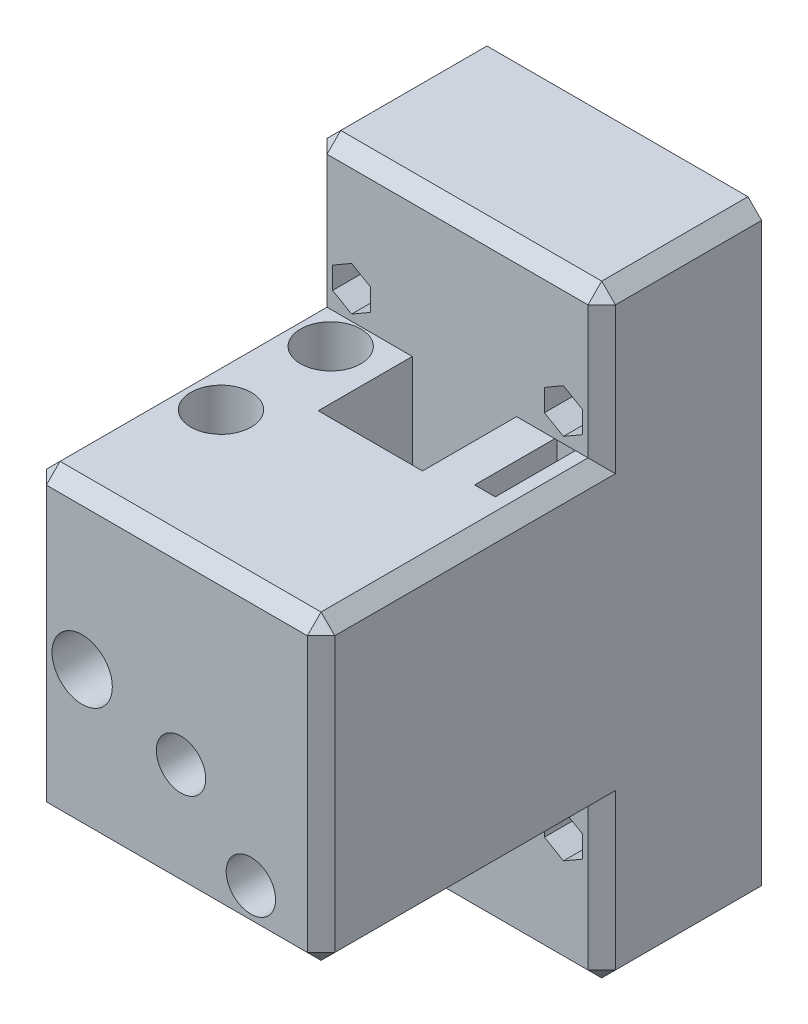
from build123d import *

# Parameters (mm, degrees)
SKETCH1_W                = 34.3
SKETCH1_H                = 70.3
SKETCH1_W_2              = 110
SKETCH1_H_2              = 9.85
BOSS_EXTRUDE1_DEPTH      = 15.048264774
BOSS_EXTRUDE3_DEPTH      = 10
BOSS_EXTRUDE4_DEPTH      = 27.518264774
CUT_EXTRUDE1_DEPTH       = 97.82308708
CUT_EXTRUDE1_DEPTH_BACK  = 97.82308708
SKETCH4_R                = 2
CUT_EXTRUDE3_DEPTH       = 77.2053469
CUT_EXTRUDE3_DEPTH_BACK  = 77.2053469
SKETCH8_W                = 129.903835659
SKETCH8_H                = 83.627886417
SKETCH9_W                = 44.357950904
SKETCH9_H                = 70.607950904
SKETCH9_W_2              = 20
SKETCH9_H_2              = 40
BOSS_EXTRUDE5_DEPTH      = 15.048264774
SKETCH10_W               = 20.2
SKETCH10_H               = 40.2
SKETCH10_W_2             = 20
SKETCH10_H_2             = 40
CUT_EXTRUDE6_DEPTH       = 81.359319258
SKETCH11_R               = 3
CUT_EXTRUDE7_DEPTH       = 30
CUT_EXTRUDE8_DEPTH       = 105.313703151
CUT_EXTRUDE8_DEPTH_BACK  = 8
SKETCH12_R               = 5.5
CUT_EXTRUDE10_DEPTH      = 81.359319258
CUT_EXTRUDE10_DEPTH_BACK = 81.359319258
SKETCH14_W               = 7.032197939
SKETCH14_H               = 32
SKETCH19_W               = 44.357950904
SKETCH19_H               = 70.453975452
BOSS_EXTRUDE9_DEPTH      = 3
BOSS_EXTRUDE6_DEPTH      = 19.3
SKETCH16_R               = 3.4
BOSS_EXTRUDE7_DEPTH      = 2.35
SKETCH18_W               = 18.048264774
SKETCH18_H               = 5.321024548
BOSS_EXTRUDE8_DEPTH      = 15
SKETCH20_R               = 3.4
BOSS_EXTRUDE10_DEPTH     = 1.85
BOSS_EXTRUDE11_DEPTH     = 15.85
SKETCH22_R               = 3.4
BOSS_EXTRUDE12_DEPTH     = 1.8
BOSS_EXTRUDE13_OUTLINE_R = 3.4
BOSS_EXTRUDE13_DEPTH     = 34.003975452
SKETCH26_W               = 18.048264774
SKETCH26_H               = 2.15
BOSS_EXTRUDE16_DEPTH     = 5.321024548
SKETCH24_R               = 3.4
BOSS_EXTRUDE14_DEPTH     = 1.8
BOSS_EXTRUDE15_DEPTH     = 18.503975452
CUT_EXTRUDE11_DEPTH      = 83.549671178
CUT_EXTRUDE11_DEPTH_BACK = 83.549671178
SKETCH27_R               = 2.5
CUT_EXTRUDE12_DEPTH      = 81.923545348
CUT_EXTRUDE12_DEPTH_BACK = 81.923545348
SKETCH28_R               = 2.5
CUT_EXTRUDE15_DEPTH      = 102.880674814
CUT_EXTRUDE15_DEPTH_BACK = 102.880674814
SKETCH29_W               = 3.770821646
SKETCH29_H               = 15
SKETCH30_W               = 52.566529548
SKETCH30_H               = 26.651024548
SKETCH30_R               = 2
SKETCH30_H_2             = 28.348975452
BOSS_EXTRUDE17_DEPTH     = 19.3
CHAMFER1_SIZE            = 2.5
CUT_EXTRUDE16_DEPTH      = 84.96040374
CUT_EXTRUDE16_DEPTH_BACK = 10
SKETCH31_R               = 3
CUT_EXTRUDE17_DEPTH      = 33
SKETCH33_R               = 5.5
CUT_EXTRUDE18_DEPTH      = 8
CUT_EXTRUDE19_DEPTH      = 20
CUT_EXTRUDE20_DEPTH      = 33
SKETCH36_R               = 4.5
CUT_EXTRUDE21_DEPTH      = 12
SKETCH37_R               = 4.5
CUT_EXTRUDE22_DEPTH      = 4


# Read off the part's stored shape, not the designer's step: Boss-Extrude13
with BuildPart() as part:
    # Sketch1 → Boss-Extrude1 (new body)
    # profile 1 of 2: a face of its own
    with BuildSketch(Plane.YZ):
        Rectangle(SKETCH1_W, SKETCH1_H)
        with BuildLine():
            Line((-10.15, 6.7), (-10.15, -6.7))
            ThreePointArc((-10.15, -6.7), (-9.871751442, -7.371751442), (-9.2, -7.65))
            Line((-9.2, -7.65), (-8.5, -7.65))
            ThreePointArc((-8.5, -7.65), (-8.181801948, -7.518198052), (-8.05, -7.2))
            Line((-8.05, -7.2), (-8.05, -5.094911614))
            ThreePointArc((-8.05, -5.094911614), (-7.621019548, -4.452896997), (-6.863711672, -4.603534899))
            Line((-6.863711672, -4.603534899), (-4.684745674, -6.782500897))
            ThreePointArc((-4.684745674, -6.782500897), (-4.066943332, -7.707107441), (-3.85, -8.797755224))
            Line((-3.85, -8.797755224), (-3.85, -11.202244776))
            ThreePointArc((-3.85, -11.202244776), (-4.066943332, -12.292892559), (-4.684745674, -13.217499103))
            Line((-4.684745674, -13.217499103), (-6.863711672, -15.396465101))
            ThreePointArc((-6.863711672, -15.396465101), (-7.621019548, -15.547103003), (-8.05, -14.905088386))
            Line((-8.05, -14.905088386), (-8.05, -12.8))
            ThreePointArc((-8.05, -12.8), (-8.181801948, -12.481801948), (-8.5, -12.35))
            Line((-8.5, -12.35), (-9.2, -12.35))
            ThreePointArc((-9.2, -12.35), (-9.871751442, -12.628248558), (-10.15, -13.3))
            Line((-10.15, -13.3), (-10.15, -18))
            ThreePointArc((-10.15, -18), (-9.52027958, -19.52027958), (-8, -20.15))
            Line((-8, -20.15), (-3.3, -20.15))
            ThreePointArc((-3.3, -20.15), (-2.628248558, -19.871751442), (-2.35, -19.2))
            Line((-2.35, -19.2), (-2.35, -18.5))
            ThreePointArc((-2.35, -18.5), (-2.481801948, -18.181801948), (-2.8, -18.05))
            Line((-2.8, -18.05), (-4.905088386, -18.05))
            ThreePointArc((-4.905088386, -18.05), (-5.547103003, -17.621019548), (-5.396465101, -16.863711672))
            Line((-5.396465101, -16.863711672), (-3.217499103, -14.684745674))
            ThreePointArc((-3.217499103, -14.684745674), (-2.292892559, -14.066943332), (-1.202244776, -13.85))
            Line((-1.202244776, -13.85), (1.202244776, -13.85))
            ThreePointArc((1.202244776, -13.85), (2.292892559, -14.066943332), (3.217499103, -14.684745674))
            Line((3.217499103, -14.684745674), (5.396465101, -16.863711672))
            ThreePointArc((5.396465101, -16.863711672), (5.547103003, -17.621019548), (4.905088386, -18.05))
            Line((4.905088386, -18.05), (2.8, -18.05))
            ThreePointArc((2.8, -18.05), (2.481801948, -18.181801948), (2.35, -18.5))
            Line((2.35, -18.5), (2.35, -19.2))
            ThreePointArc((2.35, -19.2), (2.628248558, -19.871751442), (3.3, -20.15))
            Line((3.3, -20.15), (8, -20.15))
            ThreePointArc((8, -20.15), (9.52027958, -19.52027958), (10.15, -18))
            Line((10.15, -18), (10.15, -13.3))
            ThreePointArc((10.15, -13.3), (9.871751442, -12.628248558), (9.2, -12.35))
            Line((9.2, -12.35), (8.5, -12.35))
            ThreePointArc((8.5, -12.35), (8.181801948, -12.481801948), (8.05, -12.8))
            Line((8.05, -12.8), (8.05, -14.905088386))
            ThreePointArc((8.05, -14.905088386), (7.621019548, -15.547103003), (6.863711672, -15.396465101))
            Line((6.863711672, -15.396465101), (4.684745674, -13.217499103))
            ThreePointArc((4.684745674, -13.217499103), (4.066943332, -12.292892559), (3.85, -11.202244776))
            Line((3.85, -11.202244776), (3.85, -8.797755224))
            ThreePointArc((3.85, -8.797755224), (4.066943332, -7.707107441), (4.684745674, -6.782500897))
            Line((4.684745674, -6.782500897), (6.863711672, -4.603534899))
            ThreePointArc((6.863711672, -4.603534899), (7.621019548, -4.452896997), (8.05, -5.094911614))
            Line((8.05, -5.094911614), (8.05, -7.2))
            ThreePointArc((8.05, -7.2), (8.181801948, -7.518198052), (8.5, -7.65))
            Line((8.5, -7.65), (9.2, -7.65))
            ThreePointArc((9.2, -7.65), (9.871751442, -7.371751442), (10.15, -6.7))
            Line((10.15, -6.7), (10.15, 6.7))
            ThreePointArc((10.15, 6.7), (9.871751442, 7.371751442), (9.2, 7.65))
            Line((9.2, 7.65), (8.5, 7.65))
            ThreePointArc((8.5, 7.65), (8.181801948, 7.518198052), (8.05, 7.2))
            Line((8.05, 7.2), (8.05, 5.094911614))
            ThreePointArc((8.05, 5.094911614), (7.621019548, 4.452896997), (6.863711672, 4.603534899))
            Line((6.863711672, 4.603534899), (4.684745674, 6.782500897))
            ThreePointArc((4.684745674, 6.782500897), (4.066943332, 7.707107441), (3.85, 8.797755224))
            Line((3.85, 8.797755224), (3.85, 11.202244776))
            ThreePointArc((3.85, 11.202244776), (4.066943332, 12.292892559), (4.684745674, 13.217499103))
            Line((4.684745674, 13.217499103), (6.863711672, 15.396465101))
            ThreePointArc((6.863711672, 15.396465101), (7.621019548, 15.547103003), (8.05, 14.905088386))
            Line((8.05, 14.905088386), (8.05, 12.8))
            ThreePointArc((8.05, 12.8), (8.181801948, 12.481801948), (8.5, 12.35))
            Line((8.5, 12.35), (9.2, 12.35))
            ThreePointArc((9.2, 12.35), (9.871751442, 12.628248558), (10.15, 13.3))
            Line((10.15, 13.3), (10.15, 18))
            ThreePointArc((10.15, 18), (9.52027958, 19.52027958), (8, 20.15))
            Line((8, 20.15), (3.3, 20.15))
            ThreePointArc((3.3, 20.15), (2.628248558, 19.871751442), (2.35, 19.2))
            Line((2.35, 19.2), (2.35, 18.5))
            ThreePointArc((2.35, 18.5), (2.481801948, 18.181801948), (2.8, 18.05))
            Line((2.8, 18.05), (4.905088386, 18.05))
            ThreePointArc((4.905088386, 18.05), (5.547103003, 17.621019548), (5.396465101, 16.863711672))
            Line((5.396465101, 16.863711672), (3.217499103, 14.684745674))
            ThreePointArc((3.217499103, 14.684745674), (2.292892559, 14.066943332), (1.202244776, 13.85))
            Line((1.202244776, 13.85), (-1.202244776, 13.85))
            ThreePointArc((-1.202244776, 13.85), (-2.292892559, 14.066943332), (-3.217499103, 14.684745674))
            Line((-3.217499103, 14.684745674), (-5.396465101, 16.863711672))
            ThreePointArc((-5.396465101, 16.863711672), (-5.547103003, 17.621019548), (-4.905088386, 18.05))
            Line((-4.905088386, 18.05), (-2.8, 18.05))
            ThreePointArc((-2.8, 18.05), (-2.481801948, 18.181801948), (-2.35, 18.5))
            Line((-2.35, 18.5), (-2.35, 19.2))
            ThreePointArc((-2.35, 19.2), (-2.628248558, 19.871751442), (-3.3, 20.15))
            Line((-3.3, 20.15), (-8, 20.15))
            ThreePointArc((-8, 20.15), (-9.52027958, 19.52027958), (-10.15, 18))
            Line((-10.15, 18), (-10.15, 13.3))
            ThreePointArc((-10.15, 13.3), (-9.871751442, 12.628248558), (-9.2, 12.35))
            Line((-9.2, 12.35), (-8.5, 12.35))
            ThreePointArc((-8.5, 12.35), (-8.181801948, 12.481801948), (-8.05, 12.8))
            Line((-8.05, 12.8), (-8.05, 14.905088386))
            ThreePointArc((-8.05, 14.905088386), (-7.621019548, 15.547103003), (-6.863711672, 15.396465101))
            Line((-6.863711672, 15.396465101), (-4.684745674, 13.217499103))
            ThreePointArc((-4.684745674, 13.217499103), (-4.066943332, 12.292892559), (-3.85, 11.202244776))
            Line((-3.85, 11.202244776), (-3.85, 8.797755224))
            ThreePointArc((-3.85, 8.797755224), (-4.066943332, 7.707107441), (-4.684745674, 6.782500897))
            Line((-4.684745674, 6.782500897), (-6.863711672, 4.603534899))
            ThreePointArc((-6.863711672, 4.603534899), (-7.621019548, 4.452896997), (-8.05, 5.094911614))
            Line((-8.05, 5.094911614), (-8.05, 7.2))
            ThreePointArc((-8.05, 7.2), (-8.181801948, 7.518198052), (-8.5, 7.65))
            Line((-8.5, 7.65), (-9.2, 7.65))
            ThreePointArc((-9.2, 7.65), (-9.871751442, 7.371751442), (-10.15, 6.7))
        make_face(mode=Mode.SUBTRACT)
    # profile 2 of 2: a face of its own
    with BuildSketch(Plane.YZ):
        with Locations((0, -40.075)):
            Rectangle(SKETCH1_W_2, SKETCH1_H_2)
    extrude(amount=-BOSS_EXTRUDE1_DEPTH)

    # Sketch2 → Boss-Extrude3 (add)
    with BuildSketch(Plane.YZ):
        Polygon((17.15, 35.15), (-17.15, 35.15), (-17.15, -35.15), (-55, -35.15), (-55, -45), (55, -45), (55, -35.15), (17.15, -35.15), align=None)
    extrude(amount=BOSS_EXTRUDE3_DEPTH)

    # Sketch3 → Boss-Extrude4 (add)
    with BuildSketch(Plane.YZ.offset(10)):
        Polygon((-17.15, -35.15), (17.15, -35.15), (55, -35.15), (55, -45), (-55, -45), (-55, -35.15), align=None)
    extrude(amount=BOSS_EXTRUDE4_DEPTH)

    # Sketch4 → Cut-Extrude1 (cut, two sides: drawn at the far end of the back side and taken through both)
    with BuildSketch(Plane.XY.offset(-35.15).offset(-CUT_EXTRUDE1_DEPTH_BACK)):
        with Locations((-8.06818722, 33.5)):
            Circle(SKETCH4_R)
        with Locations((-8.06818722, -33.5)):
            Circle(SKETCH4_R)
        with Locations((30.53818722, -33.5)):
            Circle(SKETCH4_R)
        with Locations((30.53818722, 33.5)):
            Circle(SKETCH4_R)
    extrude(amount=CUT_EXTRUDE1_DEPTH + CUT_EXTRUDE1_DEPTH_BACK, mode=Mode.SUBTRACT)

    # Sketch8 → Cut-Extrude3 (cut, two sides: drawn at the far end of the back side and taken through both)
    with BuildSketch(Plane.YZ.offset(10).offset(-CUT_EXTRUDE3_DEPTH_BACK)):
        with Locations((-9.95191783, 6.663943208)):
            Rectangle(SKETCH8_W, SKETCH8_H)
    extrude(amount=CUT_EXTRUDE3_DEPTH + CUT_EXTRUDE3_DEPTH_BACK, mode=Mode.SUBTRACT)

    # Sketch9 → Boss-Extrude5 (add)
    with BuildSketch(Plane(origin=(-15.048264774, 0, 0), x_dir=(0, -1, 0), z_dir=(-1, 0, 0))):
        with Locations((-0.848975452, 0)):
            Rectangle(SKETCH9_W, SKETCH9_H)
        Rectangle(SKETCH9_W_2, SKETCH9_H_2, mode=Mode.SUBTRACT)
    extrude(amount=-BOSS_EXTRUDE5_DEPTH)

    # Sketch10 → Cut-Extrude6 (cut, through all)
    with BuildSketch(Plane.YZ):
        Rectangle(SKETCH10_W, SKETCH10_H)
        Rectangle(SKETCH10_W_2, SKETCH10_H_2, mode=Mode.SUBTRACT)
    extrude(amount=-CUT_EXTRUDE6_DEPTH, mode=Mode.SUBTRACT)

    # Sketch11 → Cut-Extrude7 (cut)
    with BuildSketch(Plane.XY.offset(35.303975452)):
        with Locations((-6.024132387, 0)):
            Circle(SKETCH11_R)
    extrude(amount=-CUT_EXTRUDE7_DEPTH, mode=Mode.SUBTRACT)

    # Sketch12 → Cut-Extrude8 (cut, two sides: drawn at the far end of the back side and taken through both)
    with BuildSketch(Plane.XY.offset(35.303975452).offset(-CUT_EXTRUDE8_DEPTH_BACK)):
        with Locations((-6.024132387, 0)):
            Circle(SKETCH12_R)
    extrude(amount=CUT_EXTRUDE8_DEPTH + CUT_EXTRUDE8_DEPTH_BACK, mode=Mode.SUBTRACT)

    # Sketch14 → Cut-Extrude10 (cut, two sides: drawn at the far end of the back side and taken through both)
    with BuildSketch(Plane.YZ.offset(-CUT_EXTRUDE10_DEPTH_BACK)):
        with Locations((-12.813901031, 0.15)):
            Rectangle(SKETCH14_W, SKETCH14_H)
    extrude(amount=CUT_EXTRUDE10_DEPTH + CUT_EXTRUDE10_DEPTH_BACK, mode=Mode.SUBTRACT)

    # Sketch19 → Boss-Extrude9 (add)
    # profile 1 of 2: a face of its own
    with BuildSketch(Plane.YZ):
        with Locations((0.848975452, 0.076987726)):
            Rectangle(SKETCH19_W, SKETCH19_H)
        Polygon((-16.33, -15.85), (-16.33, 16.15), (-10.1, 16.15), (-10.1, 20.1), (10.1, 20.1), (10.1, -20.1), (-10.1, -20.1), (-10.1, -15.85), align=None, mode=Mode.SUBTRACT)
    # profile 2 of 2: a face of its own
    with BuildSketch(Plane.YZ):
        Polygon((-10.1, 16.15), (-10.1, -15.85), (-10.1, -20.1), (10.1, -20.1), (10.1, 20.1), (-10.1, 20.1), align=None)
    extrude(amount=BOSS_EXTRUDE9_DEPTH)

    # Sketch15 → Boss-Extrude6 (add)
    with BuildSketch(Plane.XY.offset(-35.15)):
        Polygon((37.518264774, 28.348975452), (-15.048264774, 28.348975452), (-15.048264774, 23.027950904), (3, 23.027950904), (3, -21.33), (-15.048264774, -21.33), (-15.048264774, -26.651024548), (37.518264774, -26.651024548), align=None)
    extrude(amount=BOSS_EXTRUDE6_DEPTH)

    # Sketch16 → Boss-Extrude7 (add)
    with BuildSketch(Plane.XY.offset(-15.85)):
        with Locations(Location((12, -6, 0), (0, 0, 180))):
            Circle(SKETCH16_R)
    extrude(amount=BOSS_EXTRUDE7_DEPTH)

    # Sketch18 → Boss-Extrude8 (add)
    with BuildSketch(Plane.XY.offset(-15.85)):
        with BuildLine():
            ThreePointArc((22, -6), (19.196963711, -12.942889409), (12.359257331, -15.993544625))
            Line((12.359257331, -15.993544625), (3, -16.33))
            Line((3, -16.33), (3, -21.33))
            Line((3, -21.33), (-15.048264774, -21.33))
            Line((-15.048264774, -21.33), (-15.048264774, -26.651024548))
            Line((-15.048264774, -26.651024548), (37.518264774, -26.651024548))
            Line((37.518264774, -26.651024548), (37.518264774, 28.348975452))
            Line((37.518264774, 28.348975452), (22, 28.348975452))
            Line((22, 28.348975452), (22, -6))
        make_face()
        with Locations((-6.024132387, 25.688463178)):
            Rectangle(SKETCH18_W, SKETCH18_H)
    extrude(amount=BOSS_EXTRUDE8_DEPTH)

    # Sketch20 → Boss-Extrude10 (add)
    with BuildSketch(Plane.XY.offset(-0.85)):
        with Locations((24.73, -18.73)):
            Circle(SKETCH20_R)
    extrude(amount=BOSS_EXTRUDE10_DEPTH)

    # Sketch21 → Boss-Extrude11 (add)
    with BuildSketch(Plane.XY.offset(-0.85)):
        Polygon((-15.048264774, -26.651024548), (14.73, -26.651024548), (14.73, -16.33), (3, -16.33), (3, -21.33), (-15.048264774, -21.33), align=None)
        with BuildLine():
            Line((34.73, -18.73), (34.73, -26.651024548))
            Line((34.73, -26.651024548), (37.518264774, -26.651024548))
            Line((37.518264774, -26.651024548), (37.518264774, 28.348975452))
            Line((37.518264774, 28.348975452), (22, 28.348975452))
            Line((22, 28.348975452), (22, -6))
            ThreePointArc((22, -6), (21.904579832, -7.378150334), (21.620140332, -8.73))
            Line((21.620140332, -8.73), (24.73, -8.73))
            ThreePointArc((24.73, -8.73), (31.801067812, -11.658932188), (34.73, -18.73))
        make_face()
    extrude(amount=BOSS_EXTRUDE11_DEPTH)

    # Boss-Extrude13 outline → Boss-Extrude13 (add)
    with BuildSketch(Plane.XY.offset(1.3)):
        with BuildLine():
            Line((22, -6), (22, 28.348975452))
            Line((22, 28.348975452), (-15.048264774, 28.348975452))
            Line((-15.048264774, 28.348975452), (-15.048264774, 23.027950904))
            Line((-15.048264774, 23.027950904), (3, 23.027950904))
            Line((3, 23.027950904), (3, -10.1))
            Line((3, -10.1), (21.566632564, -8.91196521))
            ThreePointArc((21.566632564, -8.91196521), (21.891064797, -7.472018064), (22, -6))
        make_face()
        with Locations((12, -6)):
            Circle(BOSS_EXTRUDE13_OUTLINE_R, mode=Mode.SUBTRACT)
    extrude(amount=BOSS_EXTRUDE13_DEPTH)

    # Sketch26 → Boss-Extrude16 (add)
    with BuildSketch(Plane(origin=(0, 23.027950904, 0), x_dir=(-1, 0, 0), z_dir=(0, 1, 0))):
        with Locations((6.024132387, 0.225)):
            Rectangle(SKETCH26_W, SKETCH26_H)
    extrude(amount=BOSS_EXTRUDE16_DEPTH)

    # Sketch24 → Boss-Extrude14 (add)
    with BuildSketch(Plane.XY.offset(15)):
        with Locations((24.73, -18.73)):
            Circle(SKETCH24_R)
        Polygon((14.73, -16.33), (3, -16.33), (3, -21.33), (-15.048264774, -21.33), (-15.048264774, -26.651024548), (14.73, -26.651024548), align=None)
        with BuildLine():
            Line((34.73, -18.73), (34.73, -26.651024548))
            Line((34.73, -26.651024548), (37.518264774, -26.651024548))
            Line((37.518264774, -26.651024548), (37.518264774, 28.348975452))
            Line((37.518264774, 28.348975452), (22, 28.348975452))
            Line((22, 28.348975452), (22, -6))
            ThreePointArc((22, -6), (21.904579832, -7.378150334), (21.620140332, -8.73))
            Line((21.620140332, -8.73), (24.73, -8.73))
            ThreePointArc((24.73, -8.73), (31.801067812, -11.658932188), (34.73, -18.73))
        make_face()
    extrude(amount=BOSS_EXTRUDE14_DEPTH)


with BuildPart() as body_2:
    # Sketch22 → Boss-Extrude12 (new body)
    with BuildSketch(Plane(origin=(0, 0, -0.5), x_dir=(0, -1, 0), z_dir=(0, 0, 1))):
        with Locations(Location((6, 12, 0), (0, 0, 90))):
            Circle(SKETCH22_R)
    extrude(amount=BOSS_EXTRUDE12_DEPTH)


with BuildPart() as boss_extrude14_piece_1:
    # of the separate pieces the step leaves, piece 1, a body of its own (boss_extrude14_pieces)
    add(part.part.solids().sort_by_distance((-15.048264774, -55, -45))[0])



with BuildPart() as boss_extrude14_piece_2:
    # of the separate pieces the step leaves, piece 2, a body of its own (boss_extrude14_pieces)
    add(part.part.solids().sort_by_distance((28.13, -18.73, 15))[0])


with BuildPart() as boss_extrude14_piece_1_1:
    add(boss_extrude14_piece_1.part)

    add(boss_extrude14_piece_2.part)  # Boss-Extrude15 merges Boss-Extrude14 piece 2
    # Sketch25 → Boss-Extrude15 (add)
    with BuildSketch(Plane.XY.offset(16.8)):
        Polygon((-15.048264774, -26.651024548), (14.73, -26.651024548), (14.73, -16.33), (3, -16.33), (3, -21.33), (-15.048264774, -21.33), align=None)
        with BuildLine():
            Line((37.518264774, 28.348975452), (22, 28.348975452))
            Line((22, 28.348975452), (22, -6))
            ThreePointArc((22, -6), (21.904579832, -7.378150334), (21.620140332, -8.73))
            Line((21.620140332, -8.73), (24.73, -8.73))
            ThreePointArc((24.73, -8.73), (31.801067812, -11.658932188), (34.73, -18.73))
            Line((34.73, -18.73), (34.73, -26.651024548))
            Line((34.73, -26.651024548), (37.518264774, -26.651024548))
            Line((37.518264774, -26.651024548), (37.518264774, 28.348975452))
        make_face()
        with BuildLine():
            Line((24.73, -8.73), (21.620140332, -8.73))
            ThreePointArc((21.620140332, -8.73), (18.171455627, -13.868490036), (12.359257331, -15.993544625))
            Line((12.359257331, -15.993544625), (3, -16.33))
            Line((3, -16.33), (14.73, -16.33))
            Line((14.73, -16.33), (14.73, -26.651024548))
            Line((14.73, -26.651024548), (34.73, -26.651024548))
            Line((34.73, -26.651024548), (34.73, -18.73))
            ThreePointArc((34.73, -18.73), (31.801067812, -11.658932188), (24.73, -8.73))
        make_face()
        with BuildLine():
            Line((3, -16.33), (12.359257331, -15.993544625))
            ThreePointArc((12.359257331, -15.993544625), (19.196963711, -12.942889409), (22, -6))
            Line((22, -6), (22, 28.348975452))
            Line((22, 28.348975452), (3, 28.348975452))
            Line((3, 28.348975452), (3, -10.1))
            Line((3, -10.1), (0, -10.1))
            Line((0, -10.1), (-15.048264774, -10.1))
            Line((-15.048264774, -10.1), (-15.048264774, -16.33))
            Line((-15.048264774, -16.33), (3, -16.33))
        make_face()
    extrude(amount=BOSS_EXTRUDE15_DEPTH)


with BuildPart() as cut_extrude11_tool:
    # Sketch27 → Cut-Extrude11 (new, two sides: drawn at the far end of the back side and taken through both)
    with BuildSketch(Plane.XY.offset(-13.5).offset(-CUT_EXTRUDE11_DEPTH_BACK)):
        with Locations((12, -6)):
            Circle(SKETCH27_R)
    extrude(amount=CUT_EXTRUDE11_DEPTH + CUT_EXTRUDE11_DEPTH_BACK)


with BuildPart() as body_2_1:
    add(body_2.part)

    # Cut-Extrude11: cut by cut_extrude11_tool
    add(cut_extrude11_tool.part, mode=Mode.SUBTRACT)


with BuildPart() as boss_extrude14_piece_1_2:
    add(boss_extrude14_piece_1_1.part)

    # Cut-Extrude11: cut by cut_extrude11_tool
    add(cut_extrude11_tool.part, mode=Mode.SUBTRACT)

    # Sketch28 → Cut-Extrude12 (cut, two sides: drawn at the far end of the back side and taken through both)
    with BuildSketch(Plane.XY.offset(1).offset(-CUT_EXTRUDE12_DEPTH_BACK)):
        with Locations((24.73, -18.73)):
            Circle(SKETCH28_R)
    extrude(amount=CUT_EXTRUDE12_DEPTH + CUT_EXTRUDE12_DEPTH_BACK, mode=Mode.SUBTRACT)

    # Sketch29 → Cut-Extrude15 (cut, two sides: drawn at the far end of the back side and taken through both)
    with BuildSketch(Plane(origin=(0, 28.348975452, 0), x_dir=(-1, 0, 0), z_dir=(0, 1, 0)).offset(-CUT_EXTRUDE15_DEPTH_BACK)):
        with Locations((-30.844589177, -8.75)):
            Rectangle(SKETCH29_W, SKETCH29_H)
    extrude(amount=CUT_EXTRUDE15_DEPTH + CUT_EXTRUDE15_DEPTH_BACK, mode=Mode.SUBTRACT)

    # Sketch30 → Boss-Extrude17 (add)
    # profile 1 of 2: a face of its own
    with BuildSketch(Plane.XY.offset(-35.15)):
        with Locations((11.235, 41.674487726)):
            Rectangle(SKETCH30_W, SKETCH30_H)
        with Locations((30.53818722, 33.5)):
            Circle(SKETCH30_R, mode=Mode.SUBTRACT)
        with Locations((-8.06818722, 33.5)):
            Circle(SKETCH30_R, mode=Mode.SUBTRACT)
    # profile 2 of 2: a face of its own
    with BuildSketch(Plane.XY.offset(-35.15)):
        with Locations((11.235, -40.825512274)):
            Rectangle(SKETCH30_W, SKETCH30_H_2)
        with Locations((-8.06818722, -33.5)):
            Circle(SKETCH30_R, mode=Mode.SUBTRACT)
        with Locations((30.53818722, -33.5)):
            Circle(SKETCH30_R, mode=Mode.SUBTRACT)
    extrude(amount=BOSS_EXTRUDE17_DEPTH)

    # Chamfer1
    chamfer1_edges = [boss_extrude14_piece_1_2.edges().sort_by_distance(p)[0] for p in [
        (11.235, 55, -15.85),
        (-15.048264774, 41.674487726, -15.85),
        (37.518264774, 41.674487726, -15.85),
        (37.518264774, -40.825512274, -15.85),
        (-15.048264774, -40.825512274, -15.85),
        (11.235, -55, -15.85),
        (11.235, -26.651024548, 35.303975452),
        (-15.048264774, -26.651024548, 9.726987726),
        (-15.048264774, 6.463975452, 35.303975452),
        (11.235, 28.348975452, 35.303975452),
        (37.518264774, 28.348975452, 9.726987726),
        (37.518264774, 0.848975452, 35.303975452),
        (37.518264774, -26.651024548, 9.726987726),
        (-15.048264774, 28.348975452, 18.301987726),
        (-15.048264774, -55, -25.5),
        (37.518264774, -55, -25.5),
        (-15.048264774, 55, -25.5),
        (37.518264774, 55, -25.5),
    ]]
    chamfer(chamfer1_edges, length=CHAMFER1_SIZE)

    # Sketch32 → Cut-Extrude16 (cut, two sides: drawn at the far end of the back side and taken through both)
    with BuildSketch(Plane.XY.offset(-15.85).offset(-CUT_EXTRUDE16_DEPTH_BACK)):
        Polygon((-4.604085605, 35.5), (-8.06818722, 37.5), (-11.532288835, 35.5), (-11.532288835, 31.5), (-8.06818722, 29.5), (-4.604085605, 31.5), align=None)
        Polygon((30.53818722, 29.5), (34.002288835, 31.5), (34.002288835, 35.5), (30.53818722, 37.5), (27.074085604, 35.5), (27.074085604, 31.5), align=None)
        Polygon((-8.06818722, -37.5), (-4.604085605, -35.5), (-4.604085605, -31.5), (-8.06818722, -29.5), (-11.532288835, -31.5), (-11.532288835, -35.5), align=None)
        Polygon((30.53818722, -37.5), (34.002288835, -35.5), (34.002288835, -31.5), (30.53818722, -29.5), (27.074085604, -31.5), (27.074085604, -35.5), align=None)
    extrude(amount=CUT_EXTRUDE16_DEPTH + CUT_EXTRUDE16_DEPTH_BACK, mode=Mode.SUBTRACT)

    # Sketch31 → Cut-Extrude17 (cut)
    with BuildSketch(Plane(origin=(0, 3.7, 0), x_dir=(-1, 0, 0), z_dir=(0, 1, 0))):
        with Locations(Location((6.024132387, -10, 0), (0, 0, 270))):
            Circle(SKETCH31_R)
        with Locations(Location((6.024132387, 10, 0), (0, 0, 270))):
            Circle(SKETCH31_R)
    extrude(amount=CUT_EXTRUDE17_DEPTH, mode=Mode.SUBTRACT)

    # Sketch33 → Cut-Extrude18 (cut)
    with BuildSketch(Plane(origin=(0, 28.348975452, 0), x_dir=(-1, 0, 0), z_dir=(0, 1, 0))):
        with Locations(Location((6.024132387, 10, 0), (0, 0, 90))):
            Circle(SKETCH33_R)
        with Locations(Location((6.024132387, -10, 0), (0, 0, 90))):
            Circle(SKETCH33_R)
    extrude(amount=-CUT_EXTRUDE18_DEPTH, mode=Mode.SUBTRACT)

    # Sketch34 → Cut-Extrude19 (cut)
    with BuildSketch(Plane(origin=(0, 0, -45), x_dir=(1, 0, 0), z_dir=(0, 0, -1))):
        Polygon((12, 1.25), (16.113620668, 3.625), (16.113620668, 8.375), (12, 10.75), (7.886379332, 8.375), (7.886379332, 3.625), align=None)
    extrude(amount=-CUT_EXTRUDE19_DEPTH, mode=Mode.SUBTRACT)

    # Sketch35 → Cut-Extrude20 (cut)
    with BuildSketch(Plane(origin=(0, 0, -45), x_dir=(1, 0, 0), z_dir=(0, 0, -1))):
        Polygon((24.73, 13.98), (28.843620668, 16.355), (28.843620668, 21.105), (24.73, 23.48), (20.616379332, 21.105), (20.616379332, 16.355), align=None)
    extrude(amount=-CUT_EXTRUDE20_DEPTH, mode=Mode.SUBTRACT)

    # Sketch36 → Cut-Extrude21 (cut)
    with BuildSketch(Plane.XY.offset(35.303975452)):
        with Locations((12, -6)):
            Circle(SKETCH36_R)
        with Locations((24.73, -18.73)):
            Circle(SKETCH36_R)
    extrude(amount=-CUT_EXTRUDE21_DEPTH, mode=Mode.SUBTRACT)

    # Sketch37 → Cut-Extrude22 (cut)
    with BuildSketch(Plane.XY.offset(23.303975452)):
        with Locations((12, -6)):
            Circle(SKETCH37_R)
    extrude(amount=-CUT_EXTRUDE22_DEPTH, mode=Mode.SUBTRACT)


solid = Compound([body_2_1.part, boss_extrude14_piece_1_2.part])
